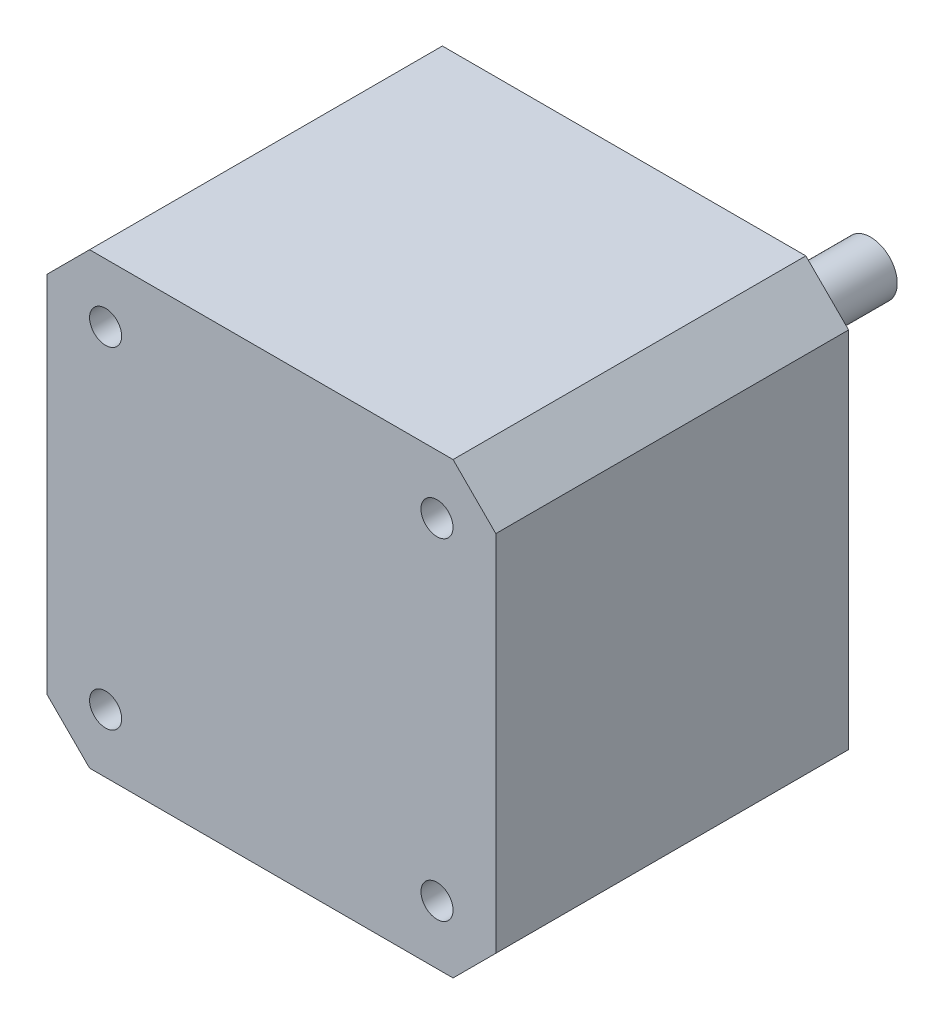
from build123d import *

# Parameters (mm, degrees)
SZKIC1_W                    = 42
SZKIC1_H                    = 42
DODANIE_WYCI_GNI_CIE1_DEPTH = 33
SFAZOWANIE1_SIZE            = 4
SZKIC2_R                    = 11
DODANIE_WYCI_GNI_CIE2_DEPTH = 1.3
SZKIC3_R                    = 2.5
DODANIE_WYCI_GNI_CIE3_DEPTH = 21.75
SZKIC4_R                    = 1.5
WYTNIJ_WYCI_GNI_CIE1_DEPTH  = 45.395945761


with BuildPart() as part:
    # Szkic1 → Dodanie-wyciągnięcie1 (new body)
    with BuildSketch(Plane.XY):
        Rectangle(SZKIC1_W, SZKIC1_H)
    extrude(amount=DODANIE_WYCI_GNI_CIE1_DEPTH)

    # Sfazowanie1
    sfazowanie1_edges = [part.edges().sort_by_distance(p)[0] for p in [
        (-21, -21, 16.5),
        (21, -21, 16.5),
        (-21, 21, 16.5),
        (21, 21, 16.5),
    ]]
    chamfer(sfazowanie1_edges, length=SFAZOWANIE1_SIZE)

    # Szkic2 → Dodanie-wyciągnięcie2 (add)
    with BuildSketch(Plane(origin=(0, 0, 0), x_dir=(-1, 0, 0), z_dir=(0, 0, -1))):
        Circle(SZKIC2_R)
    extrude(amount=DODANIE_WYCI_GNI_CIE2_DEPTH)

    # Szkic3 → Dodanie-wyciągnięcie3 (add)
    with BuildSketch(Plane(origin=(0, 0, -1.3), x_dir=(-1, 0, 0), z_dir=(0, 0, -1))):
        Circle(SZKIC3_R)
    extrude(amount=DODANIE_WYCI_GNI_CIE3_DEPTH)

    # Szkic4 → Wytnij-wyciągnięcie1 (cut, through all)
    with BuildSketch(Plane(origin=(0, 0, 0), x_dir=(-1, 0, 0), z_dir=(0, 0, -1))):
        with Locations((15.5, 15.5)):
            Circle(SZKIC4_R)
        with Locations((-15.5, 15.5)):
            Circle(SZKIC4_R)
        with Locations((-15.5, -15.5)):
            Circle(SZKIC4_R)
        with Locations((15.5, -15.5)):
            Circle(SZKIC4_R)
    extrude(amount=-WYTNIJ_WYCI_GNI_CIE1_DEPTH, mode=Mode.SUBTRACT)


solid = part.part
